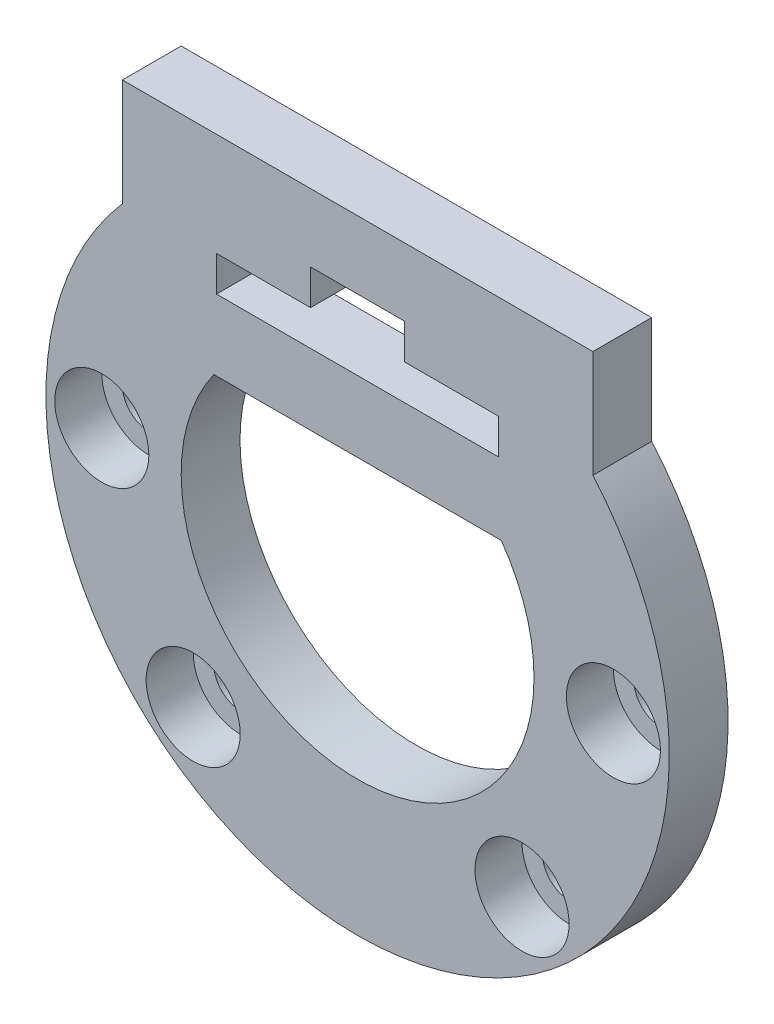
from build123d import *

# Parameters (mm, degrees)
EXTRUDE_1_DEPTH              = 5
HOLE_WIZARD_M4_1_D           = 4.5
HOLE_WIZARD_M4_1_CBORE_D     = 8
HOLE_WIZARD_M4_1_CBORE_DEPTH = 4
CUT_EXTRUDE_5_DEPTH          = 10
CUT_EXTRUDE_6_DEPTH          = 10


with BuildPart() as part:
    # 草图1 → 凸台-拉伸1 (new body)
    with BuildSketch(Plane.XY):
        with BuildLine():
            Line((0, 26.5), (20, 26.5))
            Line((20, 26.5), (20, 17.385338651))
            ThreePointArc((20, 17.385338651), (0, -26.5), (-20, 17.385338651))
            Line((-20, 17.385338651), (-20, 26.5))
            Line((-20, 26.5), (0, 26.5))
        make_face()
    extrude(amount=EXTRUDE_1_DEPTH)

    # M4 六角凹头盖的柱孔1 (through all)
    with Locations(Plane(origin=(-21.75, 0, 5), x_dir=(1, 0, 0), z_dir=(0, 0, 1))):
        with Locations((0, 0), (7.76936949, -16.66146664), (35.73063051, -16.66146664), (43.5, 0)):
            CounterBoreHole(HOLE_WIZARD_M4_1_D / 2, HOLE_WIZARD_M4_1_CBORE_D / 2, HOLE_WIZARD_M4_1_CBORE_DEPTH)

    # 草图17 → 切除-拉伸5 (cut)
    with BuildSketch(Plane.XY.offset(5)):
        Polygon((-4, 17.731710497), (-4, 20.731710497), (4, 20.731710497), (4, 17.731710497), (12, 17.731710497), (12, 14.731710497), (9, 14.731710497), (-9, 14.731710497), (-12, 14.731710497), (-12, 17.731710497), align=None)
    extrude(amount=-CUT_EXTRUDE_5_DEPTH, mode=Mode.SUBTRACT)

    # 草图18 → 切除-拉伸6 (cut)
    with BuildSketch(Plane.XY.offset(5)):
        with BuildLine():
            Line((-7.981854421, 8.7), (-12.219247113, 8.7))
            ThreePointArc((-12.219247113, 8.7), (0, -15), (12.219247113, 8.7))
            Line((12.219247113, 8.7), (-7.981854421, 8.7))
        make_face()
    extrude(amount=-CUT_EXTRUDE_6_DEPTH, mode=Mode.SUBTRACT)


solid = part.part
